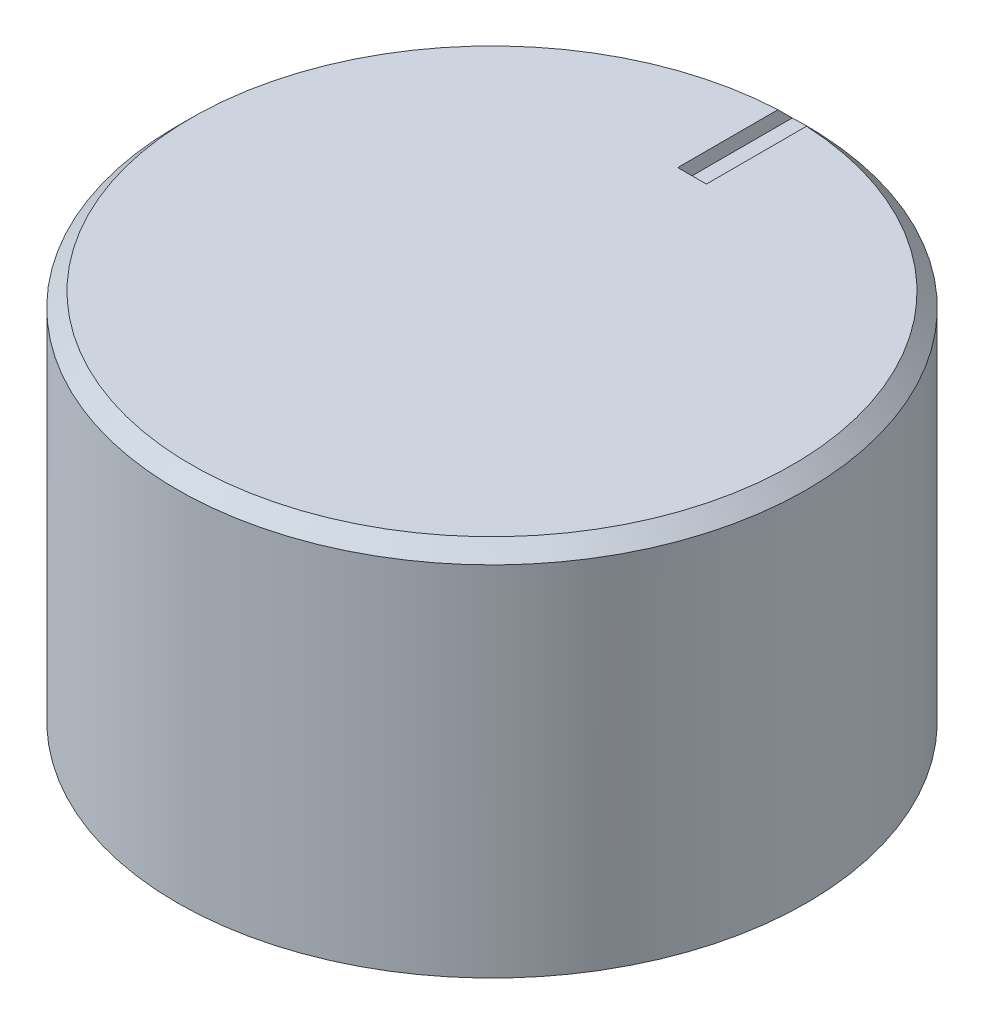
from build123d import *

# Parameters (mm, degrees)
SKETCH1_R               = 11
BOSS_EXTRUDE1_DEPTH     = 13
HOLE1_D                 = 6.35
HOLE1_DEPTH             = 10
CUT_EXTRUDE2_DEPTH      = 21.273134933
CUT_EXTRUDE2_DEPTH_BACK = 0.5
CHAMFER1_SIZE           = 0.5


with BuildPart() as part:
    # Sketch1 → Boss-Extrude1 (new body)
    with BuildSketch(Plane(origin=(0, 0, 0), x_dir=(1, 0, 0), z_dir=(0, 1, 0))):
        Circle(SKETCH1_R)
    extrude(amount=BOSS_EXTRUDE1_DEPTH)

    # Hole1
    with Locations(Plane(origin=(0, 0, 0), x_dir=(-1, 0, 0), z_dir=(0, -1, 0))):
        with Locations((0, 0)):
            Hole(HOLE1_D / 2, depth=HOLE1_DEPTH)

    # Sketch5 → Cut-Extrude2 (cut, two sides: drawn at the far end of the back side and taken through both)
    with BuildSketch(Plane(origin=(0, 13, 0), x_dir=(1, 0, 0), z_dir=(0, 1, 0)).offset(-CUT_EXTRUDE2_DEPTH_BACK)):
        Polygon((0.5, 70.617246053), (0.5, 10.988630488), (0.5, 6.988630488), (-0.5, 6.988630488), (-0.5, 10.988630488), (-0.5, 70.617246053), (-0.5, 189.874477184), (0.5, 189.874477184), align=None)
    extrude(amount=CUT_EXTRUDE2_DEPTH + CUT_EXTRUDE2_DEPTH_BACK, mode=Mode.SUBTRACT)

    # Chamfer1
    chamfer1_edges = [part.edges().sort_by_distance(p)[0] for p in [
        (-7.599342077, 13, 7.95298686),
    ]]
    chamfer(chamfer1_edges, length=CHAMFER1_SIZE)


solid = part.part
